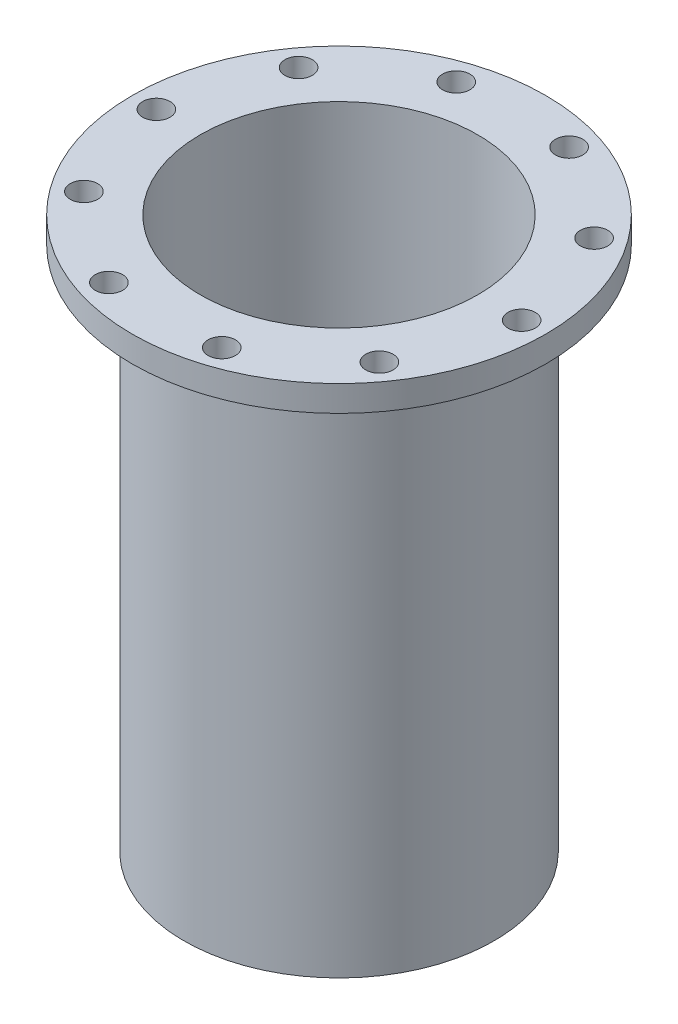
from build123d import *

# Parameters (mm, degrees)
TAP_DRILL_FOR_3_8_16_TAP1_D = 10.0838
CIRPATTERN1_COUNT           = 10


with BuildPart() as part:
    # Sketch1 → Revolve1 (revolve)
    with BuildSketch(Plane.XY):
        Polygon((51.1302, -203.2), (57.15, -203.2), (57.15, -9.525), (76.2, -9.525), (76.2, 0), (51.1302, 0), (51.1302, -185.42), (53.6702, -185.42), (53.6702, -190.5), (51.1302, -190.5), align=None)
    revolve(axis=Axis((0, 0, 0), (0, -1, 0)))

    # Tap Drill for 3/8-16 Tap1 (through all)
    with Locations(Plane(origin=(0, 0, 0), x_dir=(1, 0, 0), z_dir=(0, 1, 0))):
        with Locations((67.31, 0)):
            tap_drill_for_3_8_16_tap1 = Hole(TAP_DRILL_FOR_3_8_16_TAP1_D / 2)

    # CirPattern1: Tap Drill for 3/8-16 Tap1 ×10 about axis
    cirpattern1_axis = Axis((0, 0, 0), (0, 1, 0))
    for i in range(1, CIRPATTERN1_COUNT):
        add(tap_drill_for_3_8_16_tap1.rotate(cirpattern1_axis, i * 360 / CIRPATTERN1_COUNT), mode=Mode.SUBTRACT)


solid = part.part
